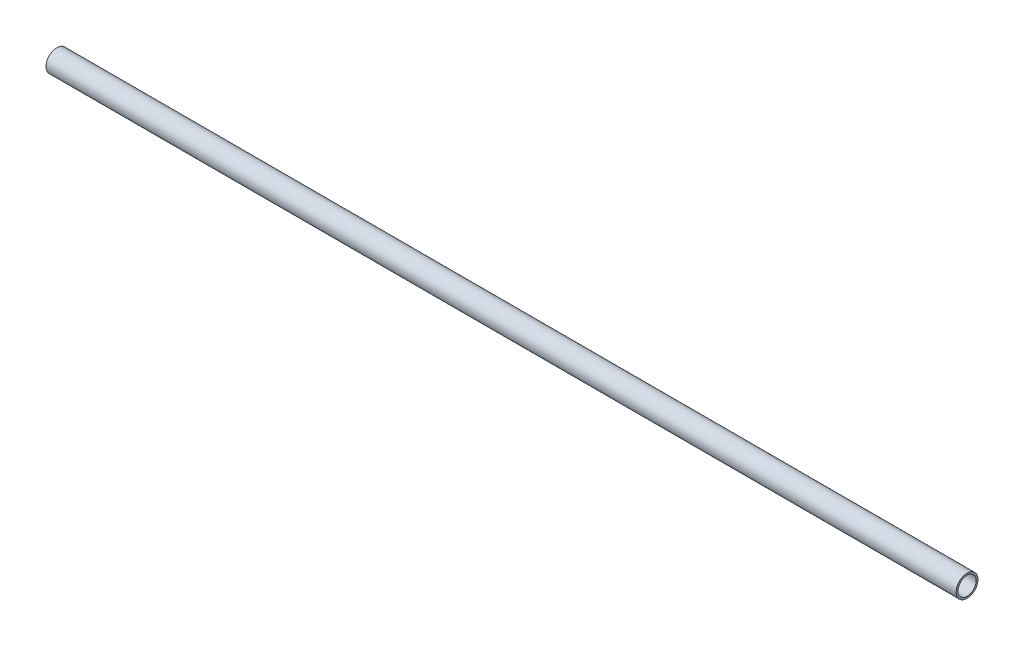
from build123d import *

# Parameters (mm, degrees)
IZIM1_R                     = 6
IZIM1_R_2                   = 5
Y_KSEKLIK_EKSTR_ZYON1_DEPTH = 250


with BuildPart() as part:
    # Çizim1 → Yükseklik-Ekstrüzyon1 (new, symmetric)
    with BuildSketch(Plane(origin=(0, 0, 0), x_dir=(0, 0, -1), z_dir=(1, 0, 0))):
        Circle(IZIM1_R)
        Circle(IZIM1_R_2, mode=Mode.SUBTRACT)
    extrude(amount=Y_KSEKLIK_EKSTR_ZYON1_DEPTH, both=True)


solid = part.part
